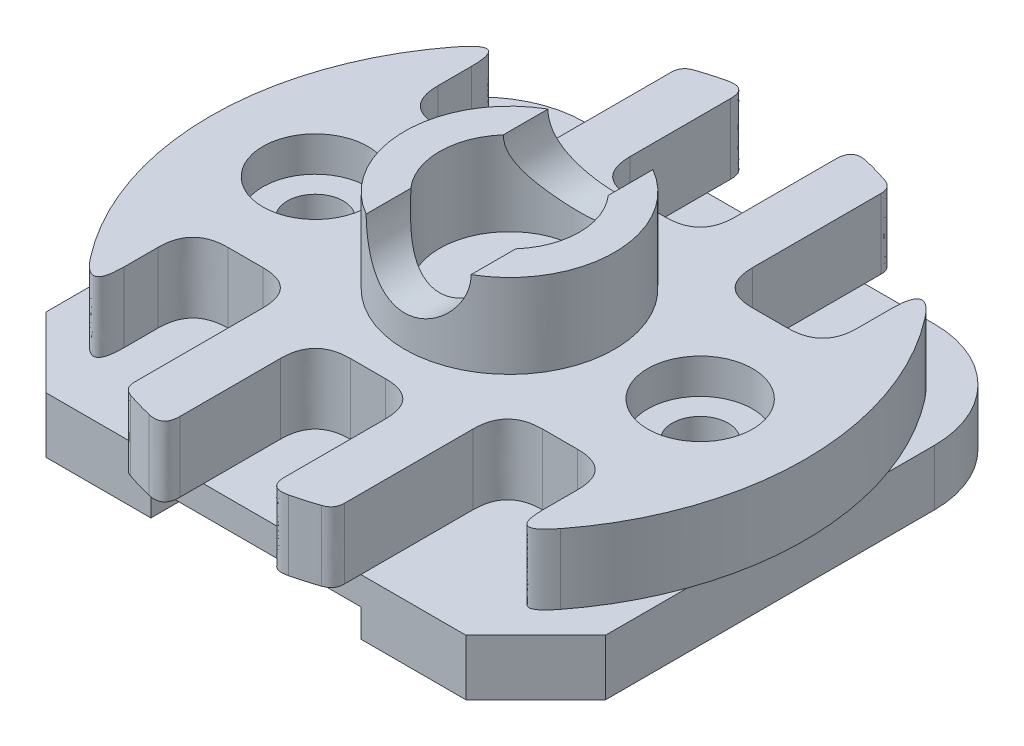
from build123d import *

# Parameters (mm, degrees)
SKETCH2_W                                = 80
SKETCH2_H                                = 72
BOSS_EXTRUDE1_DEPTH                      = 8
BOSS_EXTRUDE2_DEPTH                      = 10
CHAMFER1_SIZE                            = 10
FILLET1_R                                = 15
SKETCH4_R                                = 15
SKETCH4_R_2                              = 10
BOSS_EXTRUDE3_DEPTH                      = 12
SKETCH5_R                                = 7.5
CUT_EXTRUDE1_DEPTH                       = 118.321038589
CBORE_FOR_M10_HEX_HEAD_BOLT1_D           = 8
CBORE_FOR_M10_HEX_HEAD_BOLT1_CBORE_D     = 15
CBORE_FOR_M10_HEX_HEAD_BOLT1_CBORE_DEPTH = 5
SKETCH8_W                                = 30
SKETCH8_H                                = 4
CUT_EXTRUDE2_DEPTH                       = 118.321038614
MOVE_START                               = 17.9999999
MOVE_FACE1_OUTLINE_R                     = 15
MOVE_FACE1_OUTLINE_R_2                   = 10
MOVE_FACE1_DEPTH                         = 12.0000001
MOVE_START_2                             = -52
MOVE_FACE1_2_DEPTH                       = 32
FILLET3_SIZE                             = 5


with BuildPart() as part:
    # Sketch2 → Boss-Extrude1 (new body)
    with BuildSketch(Plane(origin=(0, 0, 0), x_dir=(1, 0, 0), z_dir=(0, 1, 0))):
        with Locations((40, 36)):
            Rectangle(SKETCH2_W, SKETCH2_H)
    extrude(amount=BOSS_EXTRUDE1_DEPTH)

    # Sketch3 → Boss-Extrude2 (add)
    with BuildSketch(Plane(origin=(0, 8, 0), x_dir=(1, 0, 0), z_dir=(0, 1, 0))):
        with BuildLine():
            Line((32.5, 77.833001327), (32.5, 56))
            Line((32.5, 56), (47.5, 56))
            Line((47.5, 56), (47.5, 77.833001327))
            ThreePointArc((47.5, 77.833001327), (51.297421179, 76.970944274), (55, 75.764934301))
            Line((55, 75.764934301), (55, 51))
            Line((55, 51), (70, 51))
            Line((70, 51), (70, 66.103986447))
            ThreePointArc((70, 66.103986447), (82.5, 36), (70, 5.896013553))
            Line((70, 5.896013553), (70, 21))
            Line((70, 21), (55, 21))
            Line((55, 21), (55, -3.764934301))
            ThreePointArc((55, -3.764934301), (51.297421179, -4.970944274), (47.5, -5.833001327))
            Line((47.5, -5.833001327), (47.5, 16))
            Line((47.5, 16), (32.5, 16))
            Line((32.5, 16), (32.5, -5.833001327))
            ThreePointArc((32.5, -5.833001327), (28.702578821, -4.970944274), (25, -3.764934301))
            Line((25, -3.764934301), (25, 21))
            Line((25, 21), (10, 21))
            Line((10, 21), (10, 5.896013553))
            ThreePointArc((10, 5.896013553), (-2.5, 36), (10, 66.103986447))
            Line((10, 66.103986447), (10, 51))
            Line((10, 51), (25, 51))
            Line((25, 51), (25, 75.764934301))
            ThreePointArc((25, 75.764934301), (28.702578821, 76.970944274), (32.5, 77.833001327))
        make_face()
    extrude(amount=BOSS_EXTRUDE2_DEPTH)

    # Chamfer1
    chamfer1_edges = [part.edges().sort_by_distance(p)[0] for p in [
        (80, 4, 0),
        (0, 4, 0),
    ]]
    chamfer(chamfer1_edges, length=CHAMFER1_SIZE)

    # Fillet1
    fillet1_edges = [part.edges().sort_by_distance(p)[0] for p in [
        (0, 4, -72),
        (80, 4, -72),
    ]]
    fillet(fillet1_edges, radius=FILLET1_R)

    # Sketch4 → Boss-Extrude3 (add)
    with BuildSketch(Plane(origin=(0, 18, 0), x_dir=(1, 0, 0), z_dir=(0, 1, 0))):
        with Locations(Location((40.253775516, 36, 0), (0, 0, 270))):
            Circle(SKETCH4_R)
        with Locations(Location((40.253775516, 36, 0), (0, 0, 270))):
            Circle(SKETCH4_R_2, mode=Mode.SUBTRACT)
    extrude(amount=BOSS_EXTRUDE3_DEPTH)

    # Sketch5 → Cut-Extrude1 (cut, through all)
    with BuildSketch(Plane(origin=(0, 0, 0), x_dir=(0, 0, -1), z_dir=(1, 0, 0))):
        with Locations((36, 30)):
            Circle(SKETCH5_R)
    extrude(amount=CUT_EXTRUDE1_DEPTH, mode=Mode.SUBTRACT)

    # CBORE for M10 Hex Head Bolt1 (through all)
    with Locations(Plane(origin=(0, 18, 0), x_dir=(1, 0, 0), z_dir=(0, 1, 0))):
        with Locations((67.5, 36), (12.5, 36)):
            CounterBoreHole(CBORE_FOR_M10_HEX_HEAD_BOLT1_D / 2, CBORE_FOR_M10_HEX_HEAD_BOLT1_CBORE_D / 2, CBORE_FOR_M10_HEX_HEAD_BOLT1_CBORE_DEPTH)

    # Sketch8 → Cut-Extrude2 (cut, through all)
    with BuildSketch(Plane(origin=(0, 0, -72), x_dir=(-1, 0, 0), z_dir=(0, 0, -1))):
        with Locations((-40, 2)):
            Rectangle(SKETCH8_W, SKETCH8_H)
    extrude(amount=-CUT_EXTRUDE2_DEPTH, mode=Mode.SUBTRACT)

    # Fillet2
    # a fillet whose section is not a circle: 2 mm, written as the material it takes off along each edge
    with BuildSketch(Plane(origin=(25, 4.393986535, -75.764934301), x_dir=(0, 0, 1), z_dir=(0, 1, 0)), Plane(origin=(55, 4.393986535, 3.764934301), x_dir=(0, 0, -1), z_dir=(0, 1, 0))) as fillet2_piece_1:
        with BuildLine():
            Bezier((1.408057473, 0), (-0.025844464, 0), (-0.486109283, 1.358024691), weights=[1, 1, 1])
            ThreePointArc((-0.486109283, 1.358024691), (-0.248816298, 0.676949942), (0, 0))
            Line((0, 0), (1.408057473, 0))
        make_face()
    extrude(amount=17.21202693, mode=Mode.SUBTRACT)
    with BuildSketch(Plane(origin=(55, 4.393986535, -75.764934301), x_dir=(0, 0, 1), z_dir=(0, 1, 0)), Plane(origin=(25, 4.393986535, 3.764934301), x_dir=(0, 0, -1), z_dir=(0, 1, 0))) as fillet2_piece_2:
        with BuildLine():
            Bezier((1.408057473, 0), (-0.025844464, 0), (-0.486109283, -1.358024691), weights=[1, 1, 1])
            ThreePointArc((-0.486109283, -1.358024691), (-0.248816298, -0.676949942), (0, 0))
            Line((0, 0), (1.408057473, 0))
        make_face()
    extrude(amount=17.21202693, mode=Mode.SUBTRACT)
    with BuildSketch(Plane(origin=(70, 8, -66.103986447), x_dir=(0.6619797982913694, 0, 0.749521678575155), z_dir=(0, 1, 0)), Plane(origin=(10, 8, -5.896013553), x_dir=(-0.6619797982913692, 0, -0.7495216785751551), z_dir=(0, 1, 0))) as fillet2_piece_3:
        with BuildLine():
            Bezier((5.40839301, 0), (-0.420802504, 0.371654036), (3.957177107, -3.494990709), weights=[1, 1, 1])
            Line((3.957177107, -3.494990709), (0, 0))
            ThreePointArc((0, 0), (2.704196505, 0.086118767), (5.40839301, 0))
        make_face()
    extrude(amount=23.520982524, mode=Mode.SUBTRACT)
    with BuildSketch(Plane(origin=(47.5, 1.692392429, -77.833001327), x_dir=(0, 0, 1), z_dir=(0, 1, 0)), Plane(origin=(32.5, 1.692392429, 5.833001327), x_dir=(0, 0, -1), z_dir=(0, 1, 0))) as fillet2_piece_4:
        with BuildLine():
            Bezier((2.462961957, 0), (-0.077040583, 0), (0.518762482, 2.469135802), weights=[1, 1, 1])
            ThreePointArc((0.518762482, 2.469135802), (0.241054451, 1.238418338), (0, 0))
            Line((0, 0), (2.462961957, 0))
        make_face()
    extrude(amount=22.615215142, mode=Mode.SUBTRACT)
    with BuildSketch(Plane(origin=(10, 8, -66.103986447), x_dir=(-0.6619797982913697, 0, 0.7495216785751547), z_dir=(0, 1, 0)), Plane(origin=(70, 8, -5.896013553), x_dir=(0.6619797982913699, 0, -0.7495216785751544), z_dir=(0, 1, 0))) as fillet2_piece_5:
        with BuildLine():
            Bezier((5.40839301, 0), (-0.420802504, -0.371654036), (3.957177107, 3.494990709), weights=[1, 1, 1])
            Line((3.957177107, 3.494990709), (0, 0))
            ThreePointArc((0, 0), (2.704196505, -0.086118767), (5.40839301, 0))
        make_face()
    extrude(amount=23.520982524, mode=Mode.SUBTRACT)
    with BuildSketch(Plane(origin=(32.5, 1.692392429, -77.833001327), x_dir=(-0.9786340441453192, 0, 0.20560984324632328), z_dir=(0, 1, 0))) as fillet2_piece_6:
        with BuildLine():
            Bezier((2.523043028, 0), (-0.015840302, -0.075394538), (0.506409222, 2.41033842), weights=[1, 1, 1])
            Line((0.506409222, 2.41033842), (0, 0))
            ThreePointArc((0, 0), (1.261521514, -0.018726909), (2.523043028, 0))
        make_face()
    extrude(amount=22.615215142, mode=Mode.SUBTRACT)
    with BuildSketch(Plane(origin=(47.5, 1.692392429, 5.833001327), x_dir=(0, 0, -1), z_dir=(0, 1, 0))) as fillet2_piece_7:
        with BuildLine():
            Bezier((2.462961957, 0), (-0.077040583, 0), (0.518762482, -2.469135802), weights=[1, 1, 1])
            ThreePointArc((0.518762482, -2.469135802), (0.241054451, -1.238418338), (0, 0))
            Line((0, 0), (2.462961957, 0))
        make_face()
    extrude(amount=22.615215142, mode=Mode.SUBTRACT)

    # Move Face1: read off the stored shape, not the designer's step
    # Move Face1 outline → Move Face1 (add)
    with BuildSketch(Plane(origin=(0, 0, 0), x_dir=(1, 0, 0), z_dir=(0, 1, 0)).offset(MOVE_START)):
        with Locations((40.253775516, 36)):
            Circle(MOVE_FACE1_OUTLINE_R)
        with Locations((40.253775516, 36)):
            Circle(MOVE_FACE1_OUTLINE_R_2, mode=Mode.SUBTRACT)
    extrude(amount=MOVE_FACE1_DEPTH)

    # Move Face1 2 outline → Move Face1 2 (cut)
    with BuildSketch(Plane.XY.offset(MOVE_START_2)):
        with BuildLine():
            ThreePointArc((32.753775516, 30), (40.253775516, 22.5), (47.753775516, 30))
            Line((47.753775516, 30), (32.753775516, 30))
        make_face()
    extrude(amount=MOVE_FACE1_2_DEPTH, mode=Mode.SUBTRACT)

    # Fillet3
    # a fillet whose section is not a circle: 5 mm, written as the material it adds along each edge
    with BuildSketch(Plane(origin=(70, 8, -51), x_dir=(-1, 0, 0), z_dir=(0, 1, 0)), Plane(origin=(55, 8, -51), x_dir=(0, 0, -1), z_dir=(0, 1, 0)), Plane(origin=(32.5, 8, -56), x_dir=(0, 0, -1), z_dir=(0, 1, 0)), Plane(origin=(10, 8, -51), x_dir=(0, 0, -1), z_dir=(0, 1, 0)), Plane(origin=(25, 8, -21), x_dir=(0, 0, 1), z_dir=(0, 1, 0)), Plane(origin=(10, 8, -21), x_dir=(1, 0, 0), z_dir=(0, 1, 0)), Plane(origin=(47.5, 8, -16), x_dir=(0, 0, 1), z_dir=(0, 1, 0)), Plane(origin=(70, 8, -21), x_dir=(0, 0, 1), z_dir=(0, 1, 0)), Plane(origin=(55, 8, -21), x_dir=(1, 0, 0), z_dir=(0, 1, 0))) as fillet3_piece_1:
        with BuildLine():
            Bezier((FILLET3_SIZE, 0), (0, 0), (0, -FILLET3_SIZE), weights=[1, 1, 1])
            Line((0, -FILLET3_SIZE), (0, 0))
            Line((0, 0), (FILLET3_SIZE, 0))
        make_face()
    extrude(amount=10)
    with BuildSketch(Plane(origin=(47.5, 8, -56), x_dir=(0, 0, -1), z_dir=(0, 1, 0)), Plane(origin=(32.5, 8, -16), x_dir=(0, 0, 1), z_dir=(0, 1, 0))) as fillet3_piece_2:
        with BuildLine():
            Bezier((FILLET3_SIZE, 0), (0, 0), (0, FILLET3_SIZE), weights=[1, 1, 1])
            Line((0, FILLET3_SIZE), (0, 0))
            Line((0, 0), (FILLET3_SIZE, 0))
        make_face()
    extrude(amount=10)
    with BuildSketch(Plane(origin=(25, -4.5, -51), x_dir=(-1, 0, 0), z_dir=(0, 1, 0))) as fillet3_piece_3_section:
        with BuildLine():
            Bezier((FILLET3_SIZE, 0), (0, 0), (0, -FILLET3_SIZE), weights=[1, 1, 1])
            Line((0, -FILLET3_SIZE), (0, 0))
            Line((0, 0), (FILLET3_SIZE, 0))
        make_face()
    fillet3_piece_3 = extrude(amount=22.5, mode=Mode.PRIVATE)
    fillet3_piece_3 = split(fillet3_piece_3, bisect_by=Plane(origin=(25, 4, -51), z_dir=(0, 1, 0)), keep=Keep.TOP, mode=Mode.PRIVATE)
    add(fillet3_piece_3)


solid = part.part
